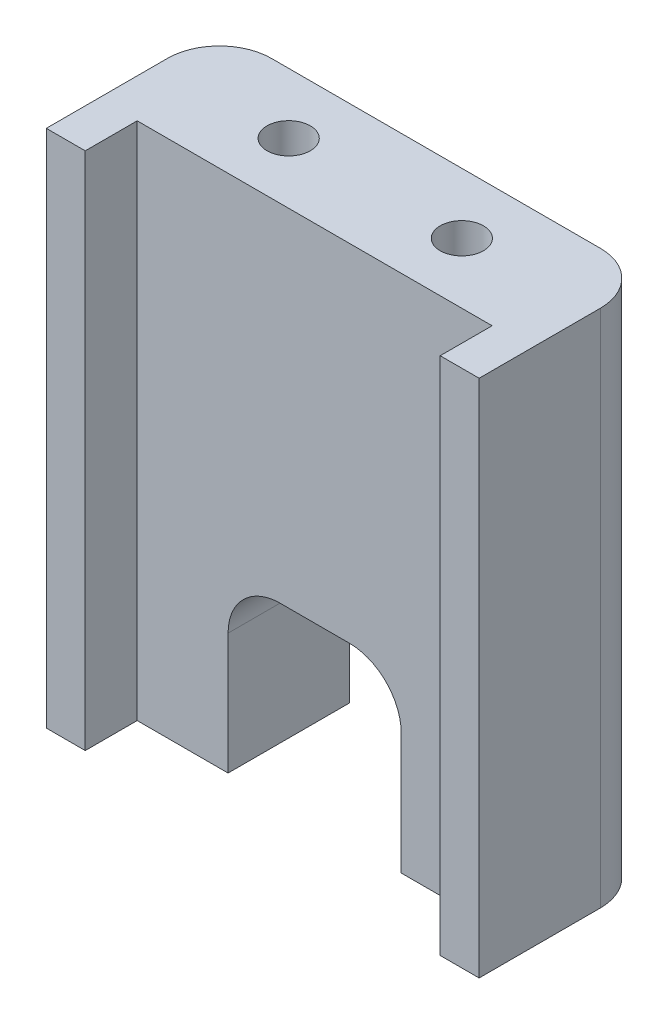
from build123d import *

# Parameters (mm, degrees)
SKETCH_1_W          = 25
SKETCH_1_H          = 30
EXTRUDE_1_DEPTH     = 10
SKETCH_2_W          = 20.5
SKETCH_2_H          = 30
CUT_EXTRUDE_1_DEPTH = 3
SKETCH_3_R          = 1.25
CUT_EXTRUDE_2_DEPTH = 12
SKETCH_4_R          = 1.25
CUT_EXTRUDE_3_DEPTH = 12
SKETCH_5_W          = 10
SKETCH_5_H          = 10
CUT_EXTRUDE_4_DEPTH = 12
FILLET_1_R          = 3


with BuildPart() as part:
    # 스케치1 → 보스-돌출1 (new body)
    with BuildSketch(Plane.XY):
        with Locations((12.5, 15)):
            Rectangle(SKETCH_1_W, SKETCH_1_H)
    extrude(amount=EXTRUDE_1_DEPTH)

    # 스케치2 → 컷-돌출1 (cut)
    with BuildSketch(Plane.XY.offset(10)):
        with Locations((12.5, 15)):
            Rectangle(SKETCH_2_W, SKETCH_2_H)
    extrude(amount=-CUT_EXTRUDE_1_DEPTH, mode=Mode.SUBTRACT)

    # 스케치3 → 컷-돌출2 (cut)
    with BuildSketch(Plane(origin=(0, 30, 0), x_dir=(1, 0, 0), z_dir=(0, 1, 0))):
        with Locations((7.5, -3.5)):
            Circle(SKETCH_3_R)
        with Locations((17.5, -3.5)):
            Circle(SKETCH_3_R)
    extrude(amount=-CUT_EXTRUDE_2_DEPTH, mode=Mode.SUBTRACT)

    # 스케치4 → 컷-돌출3 (cut)
    with BuildSketch(Plane.XZ):
        with Locations((3.5, 3.5)):
            Circle(SKETCH_4_R)
        with Locations((21.5, 3.5)):
            Circle(SKETCH_4_R)
    extrude(amount=-CUT_EXTRUDE_3_DEPTH, mode=Mode.SUBTRACT)

    # 스케치5 → 컷-돌출4 (cut)
    with BuildSketch(Plane(origin=(0, 0, 0), x_dir=(-1, 0, 0), z_dir=(0, 0, -1))):
        with Locations((-12.5, 5)):
            Rectangle(SKETCH_5_W, SKETCH_5_H)
    extrude(amount=-CUT_EXTRUDE_4_DEPTH, mode=Mode.SUBTRACT)

    # 필렛1
    fillet_1_edges = [part.edges().sort_by_distance(p)[0] for p in [
        (7.5, 10, 3.5),
        (17.5, 10, 3.5),
        (0, 15, 0),
        (25, 15, 0),
    ]]
    fillet(fillet_1_edges, radius=FILLET_1_R)


solid = part.part
